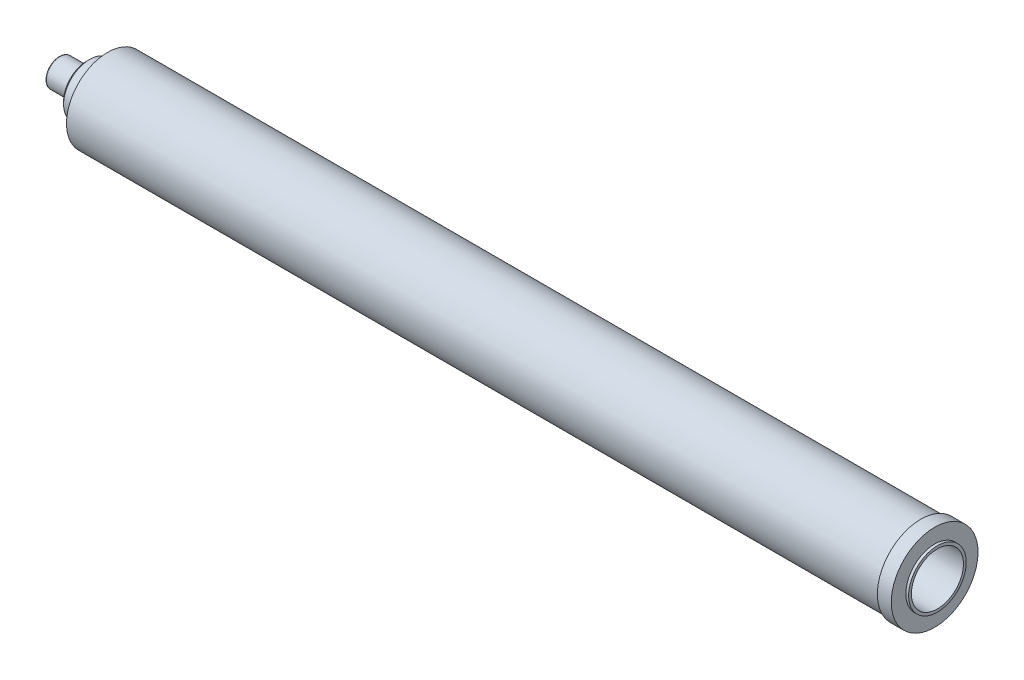
from build123d import *

# Parameters (mm, degrees)
CHAMFER1_SIZE                                       = 2.54
CSK_FOR_3_8_FLAT_HEAD_MACHINE_SCREW_100_D           = 10.0838
CSK_FOR_3_8_FLAT_HEAD_MACHINE_SCREW_100_DEPTH       = 25.4
CSK_FOR_3_8_FLAT_HEAD_MACHINE_SCREW_100_CSINK_D     = 19.3548
CSK_FOR_3_8_FLAT_HEAD_MACHINE_SCREW_100_CSINK_ANGLE = 100
CSK_FOR_3_8_FLAT_HEAD_MACHINE_SCREW_100_TIP         = 3.029479155
FILLET2_R                                           = 1.27
BOSS_EXTRUDE1_START                                 = 2.54
SKETCH5_R                                           = 26.3525
SKETCH5_R_2                                         = 23.8125
BOSS_EXTRUDE1_DEPTH                                 = 2.54
SKETCH6_R                                           = 23.8125
CUT_EXTRUDE1_DEPTH                                  = 508


with BuildPart() as part:
    # Sketch1 → Revolve1 (revolve)
    with BuildSketch(Plane.XY):
        Polygon((0, 0), (0, 12.7), (25.4, 12.7), (25.4, 23.8125), (44.45, 23.8125), (44.45, 37.6555), (788.416, 37.6555), (788.416, 39.6875), (801.116, 39.6875), (801.116, 0), align=None)
    revolve(axis=Axis((801.116, 0, 0), (-1, 0, 0)))

    # Chamfer1
    chamfer1_edges = [part.edges().sort_by_distance(p)[0] for p in [
        (25.4, -23.8125, 0),
    ]]
    chamfer(chamfer1_edges, length=CHAMFER1_SIZE)

    # CSK for 3/8 Flat Head Machine Screw (100)1
    with Locations(Plane.ZY):
        with Locations((0, 0)):
            CounterSinkHole(CSK_FOR_3_8_FLAT_HEAD_MACHINE_SCREW_100_D / 2, CSK_FOR_3_8_FLAT_HEAD_MACHINE_SCREW_100_CSINK_D / 2, depth=CSK_FOR_3_8_FLAT_HEAD_MACHINE_SCREW_100_DEPTH, counter_sink_angle=CSK_FOR_3_8_FLAT_HEAD_MACHINE_SCREW_100_CSINK_ANGLE)
            with Locations((0, 0, -(CSK_FOR_3_8_FLAT_HEAD_MACHINE_SCREW_100_DEPTH + CSK_FOR_3_8_FLAT_HEAD_MACHINE_SCREW_100_TIP / 2))):  # 118° drill point
                Cone(0, CSK_FOR_3_8_FLAT_HEAD_MACHINE_SCREW_100_D / 2, CSK_FOR_3_8_FLAT_HEAD_MACHINE_SCREW_100_TIP, mode=Mode.SUBTRACT)

    # Fillet2
    fillet2_edges = [part.edges().sort_by_distance(p)[0] for p in [
        (0, -12.7, 0),
    ]]
    fillet(fillet2_edges, radius=FILLET2_R)

    # Sketch5 → Boss-Extrude1 (add)
    with BuildSketch(Plane(origin=(801.116, 0, 0), x_dir=(0, 0, -1), z_dir=(1, 0, 0)).offset(BOSS_EXTRUDE1_START)):
        Circle(SKETCH5_R)
        Circle(SKETCH5_R_2, mode=Mode.SUBTRACT)
    extrude(amount=-BOSS_EXTRUDE1_DEPTH)

    # Sketch6 → Cut-Extrude1 (cut)
    with BuildSketch(Plane(origin=(803.656, 0, 0), x_dir=(0, 0, -1), z_dir=(1, 0, 0))):
        Circle(SKETCH6_R)
    extrude(amount=-CUT_EXTRUDE1_DEPTH, mode=Mode.SUBTRACT)


solid = part.part
